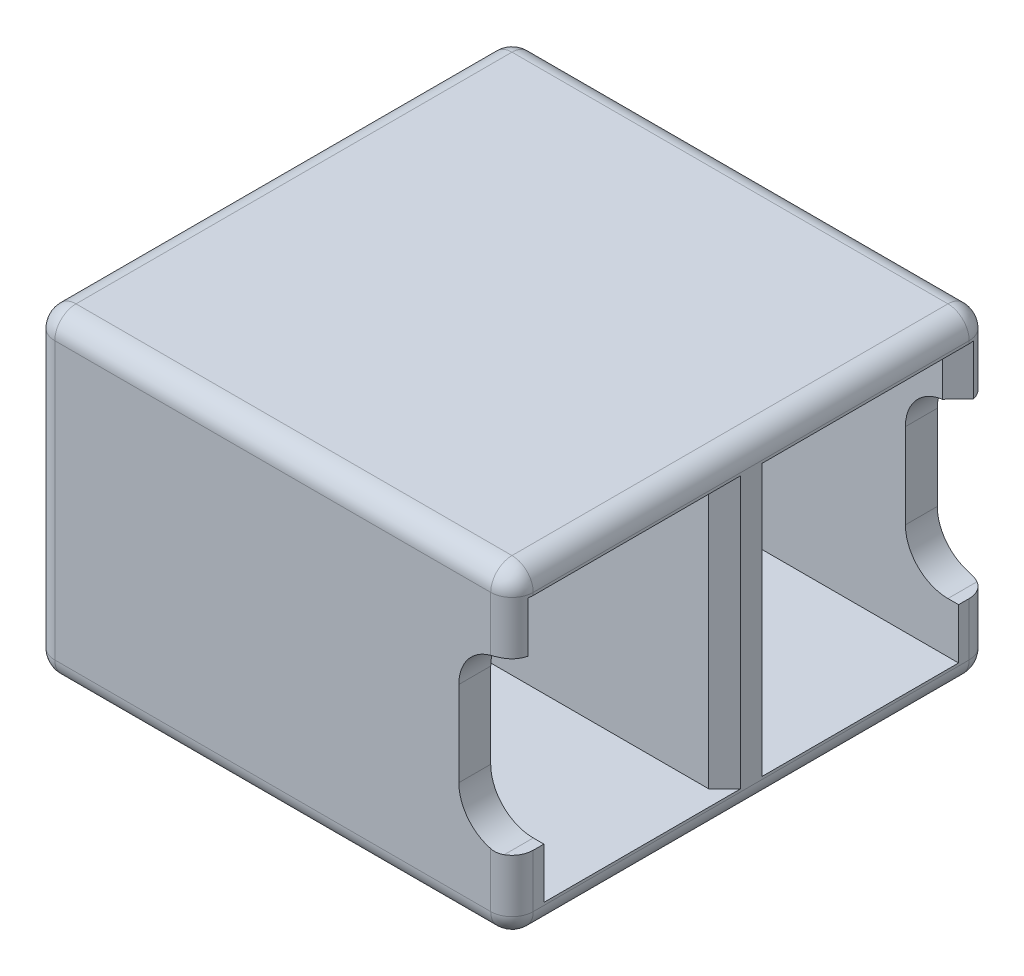
from build123d import *

# Parameters (mm, degrees)
BOSS_EXTRUDE1_DEPTH      = 15
BOSS_EXTRUDE1_DEPTH_BACK = 15
SKETCH1_W                = 45
SKETCH1_H                = 45
CUT_EXTRUDE1_DEPTH       = 12.75
CUT_EXTRUDE1_DEPTH_BACK  = 12.75
SKETCH2_W                = 38
SKETCH2_H                = 17
FILLET1_R                = 13
CUT_EXTRUDE2_REACH       = 54.5
SKETCH5_W                = 5
SKETCH5_H                = 16
FILLET2_R                = 2
CHAMFER3_SIZE            = 1.5
FILLET3_R                = 4


with BuildPart() as part:
    # Sketch1 → Boss-Extrude1 (new, two sides: drawn at the far end of the back side and taken through both)
    with BuildSketch(Plane(origin=(0, 0, 0), x_dir=(1, 0, 0), z_dir=(0, 1, 0)).offset(-BOSS_EXTRUDE1_DEPTH_BACK)):
        Rectangle(SKETCH1_W, SKETCH1_H)
    extrude(amount=BOSS_EXTRUDE1_DEPTH + BOSS_EXTRUDE1_DEPTH_BACK)

    # Sketch2 → Cut-Extrude1 (cut, two sides: drawn at the far end of the back side and taken through both)
    with BuildSketch(Plane(origin=(0, 0, 0), x_dir=(1, 0, 0), z_dir=(0, 1, 0)).offset(-CUT_EXTRUDE1_DEPTH_BACK)):
        with Locations((3.5, 11)):
            Rectangle(SKETCH2_W, SKETCH2_H)
        with Locations((3.5, -11)):
            Rectangle(SKETCH2_W, SKETCH2_H)
    extrude(amount=CUT_EXTRUDE1_DEPTH + CUT_EXTRUDE1_DEPTH_BACK, mode=Mode.SUBTRACT)

    # Fillet1
    # the kernel refuses this fillet: 13 mm, written as the material it adds along each edge
    with BuildSketch(Plane(origin=(-15.5, -12.75, -19.5), x_dir=(1, 0, 0), z_dir=(0, 0, 1))) as fillet1_piece_1_section:
        with BuildLine():
            CenterArc((FILLET1_R, FILLET1_R), FILLET1_R, 180, 90)
            Line((0, FILLET1_R), (0, 0))
            Line((0, 0), (FILLET1_R, 0))
        make_face()
    fillet1_piece_1 = extrude(amount=49.5, mode=Mode.PRIVATE)
    fillet1_piece_1 = split(fillet1_piece_1, bisect_by=Plane(origin=(-12.596216794, -9.846216794, 19.5), z_dir=(0, 0, -1)), keep=Keep.TOP, mode=Mode.PRIVATE)
    add(fillet1_piece_1)
    with BuildSketch(Plane(origin=(-15.5, 12.75, -19.5), x_dir=(1, 0, 0), z_dir=(0, 0, 1))) as fillet1_piece_2_section:
        with BuildLine():
            CenterArc((FILLET1_R, -FILLET1_R), FILLET1_R, 90, 90)
            Line((0, -FILLET1_R), (0, 0))
            Line((0, 0), (FILLET1_R, 0))
        make_face()
    fillet1_piece_2 = extrude(amount=49.5, mode=Mode.PRIVATE)
    fillet1_piece_2 = split(fillet1_piece_2, bisect_by=Plane(origin=(-12.596216794, 9.846216794, 19.5), z_dir=(0, 0, -1)), keep=Keep.TOP, mode=Mode.PRIVATE)
    add(fillet1_piece_2)
    with BuildSketch(Plane(origin=(-15.5, 12.75, 19.5), x_dir=(1, 0, 0), z_dir=(0, 0, -1))) as fillet1_piece_3_section:
        with BuildLine():
            CenterArc((FILLET1_R, FILLET1_R), FILLET1_R, 180, 90)
            Line((0, FILLET1_R), (0, 0))
            Line((0, 0), (FILLET1_R, 0))
        make_face()
    fillet1_piece_3 = extrude(amount=49.5, mode=Mode.PRIVATE)
    fillet1_piece_3 = split(fillet1_piece_3, bisect_by=Plane(origin=(-12.596216794, 9.846216794, -19.5), z_dir=(0, 0, 1)), keep=Keep.TOP, mode=Mode.PRIVATE)
    add(fillet1_piece_3)
    with BuildSketch(Plane(origin=(-15.5, -12.75, 19.5), x_dir=(1, 0, 0), z_dir=(0, 0, -1))) as fillet1_piece_4_section:
        with BuildLine():
            CenterArc((FILLET1_R, -FILLET1_R), FILLET1_R, 90, 90)
            Line((0, -FILLET1_R), (0, 0))
            Line((0, 0), (FILLET1_R, 0))
        make_face()
    fillet1_piece_4 = extrude(amount=49.5, mode=Mode.PRIVATE)
    fillet1_piece_4 = split(fillet1_piece_4, bisect_by=Plane(origin=(-12.596216794, -9.846216794, -19.5), z_dir=(0, 0, 1)), keep=Keep.TOP, mode=Mode.PRIVATE)
    add(fillet1_piece_4)

    # Sketch5 → Cut-Extrude2 (cut, up to next)
    with BuildSketch(Plane.XY.offset(22.5), mode=Mode.PRIVATE) as cut_extrude2_sk1:
        with Locations((20, 0)):
            Rectangle(SKETCH5_W, SKETCH5_H)
    cut_extrude2_tool1 = extrude(cut_extrude2_sk1.sketch, amount=-CUT_EXTRUDE2_REACH, mode=Mode.PRIVATE) & part.part
    cut_extrude2 = cut_extrude2_tool1.solids().sort_by_distance((20, 0, 22.5))[0]
    add(cut_extrude2, mode=Mode.SUBTRACT)

    # Mirror1: Cut-Extrude2 across plane
    add(cut_extrude2.mirror(Plane.XY), mode=Mode.SUBTRACT)

    # Fillet2
    fillet2_edges = [part.edges().sort_by_distance(p)[0] for p in [
        (0, 15, -22.5),
        (-22.5, 15, 0),
        (0, 15, 22.5),
        (0, -15, -22.5),
        (22.5, 15, 0),
        (-22.5, -15, 0),
        (0, -15, 22.5),
        (22.5, 11.5, 22.5),
        (-22.5, 0, 22.5),
        (-22.5, 0, -22.5),
        (22.5, -11.5, -22.5),
        (22.5, -11.5, 22.5),
        (22.5, 11.5, -22.5),
        (22.5, -15, 0),
    ]]
    fillet(fillet2_edges, radius=FILLET2_R)

    # Sketch3 → Revolve1 (revolve)
    with BuildSketch(Plane(origin=(0, 0, 0), x_dir=(1, 0, 0), z_dir=(0, 1, 0))):
        Polygon((-22.5, 0), (-32.5, 0), (-22.5, 5), align=None)
    revolve(axis=Axis((-22.5, 0, 0), (-1, 0, 0)))

    # Chamfer3
    # the kernel refuses this chamfer: 1.5 mm, written as the material it takes off along each edge
    with BuildSketch(Plane(origin=(22.5, 12.75, -19.5), x_dir=(0.0274958766105867, 0, -0.9996219169112968), z_dir=(0, -1, 0)), Plane(origin=(22.5, 4.142475518, 19.5), x_dir=(0.027495876610586768, 0, 0.9996219169112968), z_dir=(0, 1, 0))) as chamfer3_piece_1:
        Polygon((CHAMFER3_SIZE * 0.999621916911, -CHAMFER3_SIZE * 0.0274958766106), (-CHAMFER3_SIZE * 0.0274958766106, -CHAMFER3_SIZE * 0.999621916911), (0, 0), align=None)
    extrude(amount=8.607524482, mode=Mode.SUBTRACT)
    with BuildSketch(Plane(origin=(22.5, 12.75, -2.5), x_dir=(0.027495876610577594, 0, 0.999621916911297), z_dir=(0, -1, 0))) as chamfer3_piece_2:
        Polygon((CHAMFER3_SIZE * 0.999621916911, CHAMFER3_SIZE * 0.0274958766106), (-CHAMFER3_SIZE * 0.0274958766106, CHAMFER3_SIZE * 0.999621916911), (0, 0), align=None)
    extrude(amount=25.5, mode=Mode.SUBTRACT)
    with BuildSketch(Plane(origin=(22.5, 12.75, 2.5), x_dir=(0.027495876610577594, 0, -0.999621916911297), z_dir=(0, -1, 0))) as chamfer3_piece_3:
        Polygon((CHAMFER3_SIZE * 0.999621916911, -CHAMFER3_SIZE * 0.0274958766106), (-CHAMFER3_SIZE * 0.0274958766106, -CHAMFER3_SIZE * 0.999621916911), (0, 0), align=None)
    extrude(amount=25.5, mode=Mode.SUBTRACT)

    # Fillet3
    fillet3_edges = [part.edges().sort_by_distance(p)[0] for p in [
        (17.5, -8, -21),
        (17.5, 8, -21),
        (17.5, -8, 21),
        (17.5, 8, 21),
    ]]
    fillet(fillet3_edges, radius=FILLET3_R)


solid = part.part
